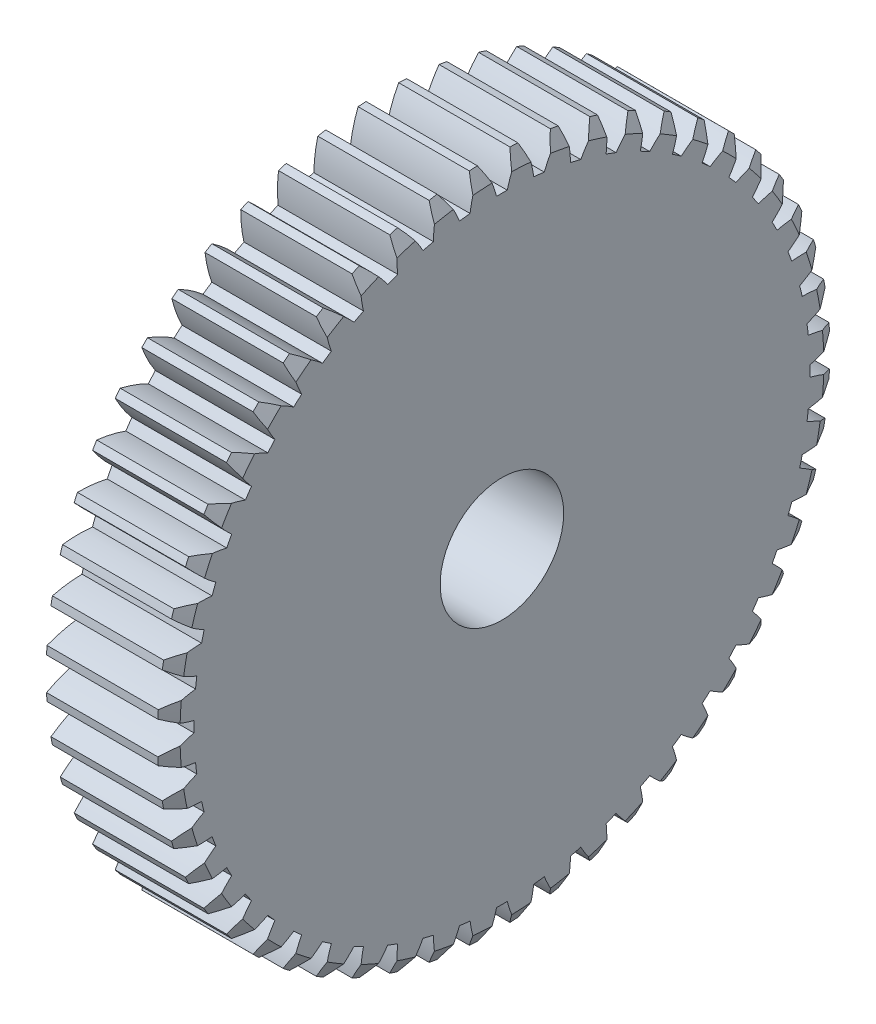
from build123d import *

# Parameters (mm, degrees)
BASPROSKE_W     = 7.62
BASPROSKE_H     = 21.43125
TOOTHCUT_DEPTH  = 32.25158161
TEETHCUTS_COUNT = 52
TEETHCUTS_ANGLE = 353.076923077
BORSKE_R        = 3.937
BORE_DEPTH      = 32.217052368


with BuildPart() as part:
    # BasProSke → Base-Revolve (revolve)
    with BuildSketch(Plane(origin=(0, 0, 0), x_dir=(1, 0, 0), z_dir=(0, 1, 0))):
        with Locations((3.81, 10.715625)):
            Rectangle(BASPROSKE_W, BASPROSKE_H)
    revolve(axis=Axis((-10, 0, 0), (1, 0, 0)))

    # TooCutSke → ToothCut (cut, through all)
    with BuildSketch(Plane(origin=(0, 0, 0), x_dir=(0, 0, -1), z_dir=(1, 0, 0))):
        with BuildLine():
            ThreePointArc((0.340444385, 19.631248235), (0, 19.6342), (-0.340444385, 19.631248235))
            ThreePointArc((-0.340444385, 19.631248235), (-0.64320584, 20.551967762), (-1.051795873, 21.430855201))
            ThreePointArc((-1.051795873, 21.430855201), (0, 21.45665), (1.051795873, 21.430855201))
            ThreePointArc((1.051795873, 21.430855201), (0.64320584, 20.551967762), (0.340444385, 19.631248235))
        make_face()
    toothcut = extrude(amount=TOOTHCUT_DEPTH, mode=Mode.SUBTRACT)

    # TeethCuts: ToothCut ×52 about axis
    teethcuts_axis = Axis((-10, 0, 0), (1, 0, 0))
    for i in range(1, TEETHCUTS_COUNT):
        add(toothcut.rotate(teethcuts_axis, i * TEETHCUTS_ANGLE / (TEETHCUTS_COUNT - 1)), mode=Mode.SUBTRACT)

    # BorSke → Bore (cut, through all)
    with BuildSketch(Plane(origin=(0, 0, 0), x_dir=(0, 0, -1), z_dir=(1, 0, 0))):
        Circle(BORSKE_R)
    extrude(amount=BORE_DEPTH, mode=Mode.SUBTRACT)

    # Sketch1 → Cut-Revolve1 (revolve, cut)
    with BuildSketch(Plane.XY):
        Polygon((6.153530316, 23.058660828), (7.62, 20.518660828), (7.62, 23.058660828), align=None)
    revolve(axis=Axis((0, 0, 0), (1, 0, 0)), mode=Mode.SUBTRACT)


solid = part.part
